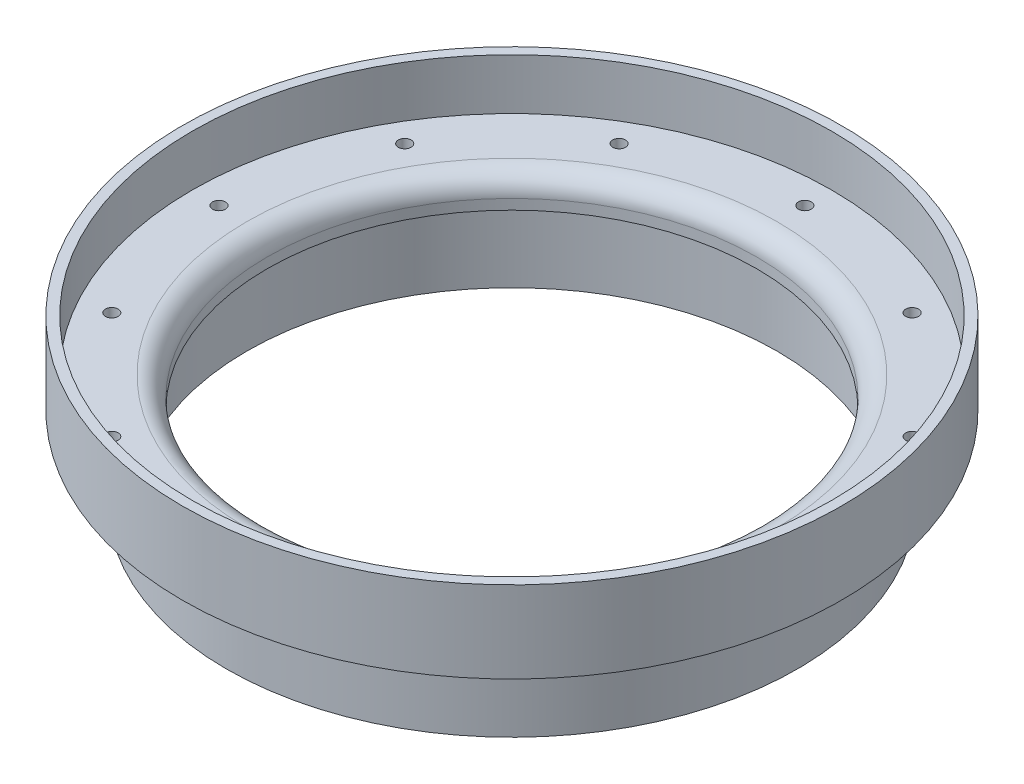
from build123d import *

# Parameters (mm, degrees)
F_3_48_TAPPED_HOLE1_D = 1.9939
CIRPATTERN1_COUNT     = 12


with BuildPart() as part:
    # Cross Section → Main (revolve)
    with BuildSketch(Plane.XY):
        with BuildLine():
            Line((-38.1, -1.5875), (-38.1, -3.175))
            Line((-38.1, -3.175), (-41.275, -3.175))
            Line((-41.275, -3.175), (-41.275, -15.875))
            Line((-41.275, -15.875), (-44.45, -15.875))
            Line((-44.45, -15.875), (-44.45, -3.175))
            Line((-44.45, -3.175), (-51.308, -3.175))
            Line((-51.308, -3.175), (-51.308, 9.525))
            Line((-51.308, 9.525), (-49.784, 9.525))
            Line((-49.784, 9.525), (-49.784, 1.5875))
            Line((-49.784, 1.5875), (-41.275, 1.5875))
            ThreePointArc((-41.275, 1.5875), (-39.02993597, 0.65756403), (-38.1, -1.5875))
        make_face()
    revolve(axis=Axis((0, 55, 0), (0, -1, 0)))

    # #3-48 Tapped Hole1 (through all)
    with Locations(Plane(origin=(0, 1.5875, 0), x_dir=(1, 0, 0), z_dir=(0, 1, 0))):
        with Locations((-45.6057, 0)):
            f_3_48_tapped_hole1 = Hole(F_3_48_TAPPED_HOLE1_D / 2)

    # CirPattern1: #3-48 Tapped Hole1 ×12 about axis
    cirpattern1_axis = Axis((0, 0, 0), (0, -1, 0))
    for i in range(1, CIRPATTERN1_COUNT):
        add(f_3_48_tapped_hole1.rotate(cirpattern1_axis, i * 360 / CIRPATTERN1_COUNT), mode=Mode.SUBTRACT)


solid = part.part
